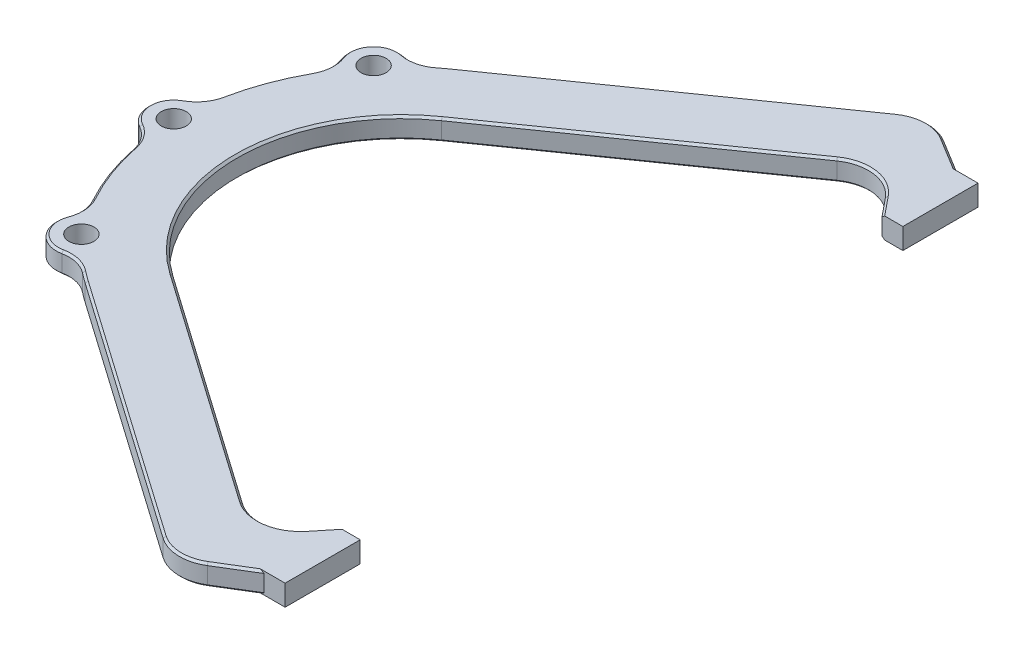
from build123d import *

# Parameters (mm, degrees)
SKETCH1_R           = 3
BOSS_EXTRUDE1_DEPTH = 2.5
CHAMFER1_SIZE       = 0.5


with BuildPart() as part:
    # Sketch1 → Boss-Extrude1 (new, symmetric)
    with BuildSketch(Plane(origin=(0, 0, 0), x_dir=(1, 0, 0), z_dir=(0, 1, 0))):
        with BuildLine():
            Line((-30.973127563, 44.234210392), (31.282427803, 87.826019554))
            ThreePointArc((31.282427803, 87.826019554), (36.708478559, 89.629701835), (42.235791097, 88.165422942))
            Line((42.235791097, 88.165422942), (50.681405689, 83))
            Line((50.681405689, 83), (55.681405689, 83))
            Line((55.681405689, 83), (55.681405689, 65))
            Line((55.681405689, 65), (50.681405689, 65))
            Line((50.681405689, 65), (47.181405689, 69.308978071))
            ThreePointArc((47.181405689, 69.308978071), (40.80368753, 72.907901658), (33.683580403, 71.195705874))
            Line((33.683580403, 71.195705874), (-22.022660441, 32.189776109))
            ThreePointArc((-22.022660441, 32.189776109), (-38.779597249, 0), (-22.022660441, -32.189776109))
            Line((-22.022660441, -32.189776109), (33.683580403, -71.195705874))
            ThreePointArc((33.683580403, -71.195705874), (40.80368753, -72.907901658), (47.181405689, -69.308978071))
            Line((47.181405689, -69.308978071), (50.681405689, -65))
            Line((50.681405689, -65), (55.681405689, -65))
            Line((55.681405689, -65), (55.681405689, -83))
            Line((55.681405689, -83), (50.681405689, -83))
            Line((50.681405689, -83), (42.235791097, -88.165422942))
            ThreePointArc((42.235791097, -88.165422942), (36.708478559, -89.629701835), (31.282427803, -87.826019554))
            Line((31.282427803, -87.826019554), (-30.973127563, -44.234210392))
            ThreePointArc((-30.973127563, -44.234210392), (-32.197046345, -43.351472947), (-33.395821369, -42.434880877))
            ThreePointArc((-33.395821369, -42.434880877), (-36.492385916, -40.938604338), (-39.931018992, -40.88065567))
            ThreePointArc((-39.931018992, -40.88065567), (-45.690855989, -38.888888889), (-46.736557051, -32.884776429))
            ThreePointArc((-46.736557051, -32.884776429), (-46.244240045, -29.481075584), (-47.226430972, -26.185190807))
            ThreePointArc((-47.226430972, -26.185190807), (-50.678277403, -18.647042647), (-52.935483871, -10.669327408))
            ThreePointArc((-52.935483871, -10.669327408), (-54.323753082, -7.5228589), (-56.904761905, -5.249986503))
            ThreePointArc((-56.904761905, -5.249986503), (-60, 0), (-56.904761905, 5.249986503))
            ThreePointArc((-56.904761905, 5.249986503), (-54.323753082, 7.5228589), (-52.935483871, 10.669327408))
            ThreePointArc((-52.935483871, 10.669327408), (-50.678277403, 18.647042647), (-47.226430972, 26.185190807))
            ThreePointArc((-47.226430972, 26.185190807), (-46.244240045, 29.481075584), (-46.736557051, 32.884776429))
            ThreePointArc((-46.736557051, 32.884776429), (-45.690855989, 38.888888889), (-39.931018992, 40.88065567))
            ThreePointArc((-39.931018992, 40.88065567), (-36.492385916, 40.938604338), (-33.395821369, 42.434880877))
            ThreePointArc((-33.395821369, 42.434880877), (-32.197046345, 43.351472947), (-30.973127563, 44.234210392))
        make_face()
        with Locations((-54, 0)):
            Circle(SKETCH1_R, mode=Mode.SUBTRACT)
        with Locations((-41.12177039, 35)):
            Circle(SKETCH1_R, mode=Mode.SUBTRACT)
        with Locations((-41.12177039, -35)):
            Circle(SKETCH1_R, mode=Mode.SUBTRACT)
    extrude(amount=BOSS_EXTRUDE1_DEPTH, both=True)

    # Chamfer1
    chamfer1_edges = [part.edges().sort_by_distance(p)[0] for p in [
        (46.458598393, 2.5, -85.582711471),
        (36.708478559, 2.5, -89.629701835),
        (0.15465012, 2.5, -66.030114973),
        (-32.197046345, 2.5, -43.351472947),
        (-36.492385916, 2.5, -40.938604338),
        (-45.690855989, 2.5, -38.888888889),
        (-46.244240045, 2.5, -29.481075584),
        (-50.678277403, 2.5, -18.647042647),
        (-54.323753082, 2.5, -7.5228589),
        (-60, 2.5, 0),
        (-54.323753082, 2.5, 7.5228589),
        (-50.678277403, 2.5, 18.647042647),
        (-46.244240045, 2.5, 29.481075584),
        (-45.690855989, 2.5, 38.888888889),
        (-36.492385916, 2.5, 40.938604338),
        (46.458598393, 2.5, 85.582711471),
        (-32.197046345, 2.5, 43.351472947),
        (36.708478559, 2.5, 89.629701835),
        (0.15465012, 2.5, 66.030114973),
        (-45.690855989, -2.5, -38.888888889),
        (-46.244240045, -2.5, -29.481075584),
        (-50.678277403, -2.5, -18.647042647),
        (-54.323753082, -2.5, -7.5228589),
        (-60, -2.5, 0),
        (-54.323753082, -2.5, 7.5228589),
        (-50.678277403, -2.5, 18.647042647),
        (-46.244240045, -2.5, 29.481075584),
        (-45.690855989, -2.5, 38.888888889),
        (-36.492385916, -2.5, 40.938604338),
        (-32.197046345, -2.5, 43.351472947),
        (0.15465012, -2.5, 66.030114973),
        (36.708478559, -2.5, 89.629701835),
        (46.458598393, -2.5, 85.582711471),
        (48.931405689, -2.5, 67.154489036),
        (40.80368753, -2.5, 72.907901658),
        (5.830459981, -2.5, 51.692740992),
        (-38.779597249, -2.5, 0),
        (5.830459981, -2.5, -51.692740992),
        (40.80368753, -2.5, -72.907901658),
        (48.931405689, -2.5, -67.154489036),
        (46.458598393, -2.5, -85.582711471),
        (36.708478559, -2.5, -89.629701835),
        (0.15465012, -2.5, -66.030114973),
        (-32.197046345, -2.5, -43.351472947),
        (-36.492385916, -2.5, -40.938604338),
        (48.931405689, 2.5, 67.154489036),
        (40.80368753, 2.5, 72.907901658),
        (5.830459981, 2.5, 51.692740992),
        (48.931405689, 2.5, -67.154489036),
        (-38.779597249, 2.5, 0),
        (40.80368753, 2.5, -72.907901658),
        (5.830459981, 2.5, -51.692740992),
    ]]
    chamfer(chamfer1_edges, length=CHAMFER1_SIZE)


solid = part.part
